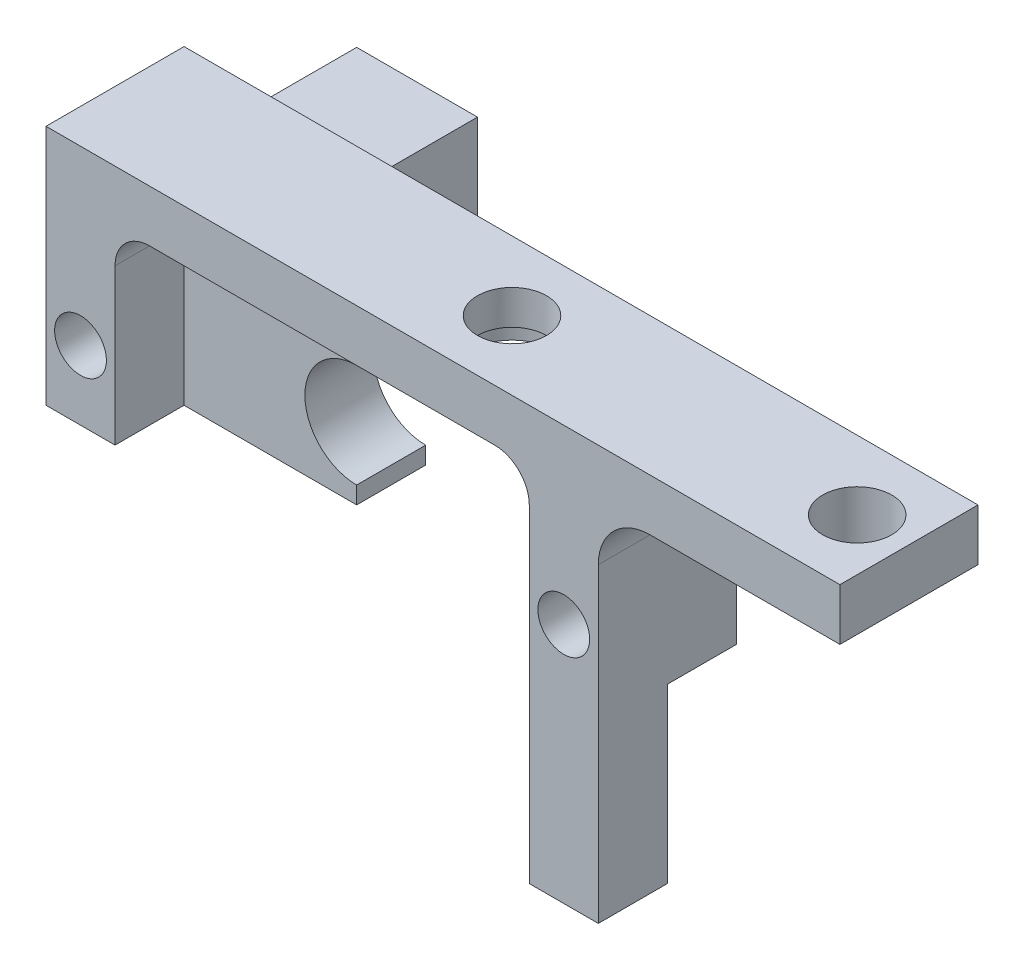
from build123d import *

# Parameters (mm, degrees)
SKETCH_1_R          = 1.5
EXTRUDE_1_DEPTH     = 8
EXTRUDE_2_DEPTH     = 4
SKETCH_4_W          = 7
SKETCH_4_H          = 14
EXTRUDE_3_DEPTH     = 10
CUT_EXTRUDE_START   = -3
CUT_EXTRUDE_1_DEPTH = 7
SKETCH_6_W          = 7
SKETCH_6_H          = 5.039650546
CUT_EXTRUDE_3_DEPTH = 10
CUT_EXTRUDE_START_2 = -10
SKETCH_7_R          = 1.5
CUT_EXTRUDE_4_DEPTH = 10
SKETCH_9_W          = 8
SKETCH_9_H          = 3
EXTRUDE_4_DEPTH     = 7
FILLET_3_R          = 3
FILLET_4_R          = 2
SKETCH_10_W         = 4
SKETCH_10_H         = 4
EXTRUDE_5_DEPTH     = 10
SKETCH_8_R          = 2
CUT_EXTRUDE_6_DEPTH = 10
SKETCH_13_R         = 2.5
CUT_EXTRUDE_7_DEPTH = 1
SKETCH_14_W         = 8
SKETCH_14_H         = 3
EXTRUDE_6_DEPTH     = 7
FILLET_5_R          = 2
SKETCH_15_R         = 2
CUT_EXTRUDE_8_DEPTH = 7


with BuildPart() as part:
    # 草图1 → 凸台-拉伸1 (new body)
    with BuildSketch(Plane.XY):
        Polygon((16, 7), (-16, 7), (-16, -7), (-12, -7), (-12, 4), (12, 4), (12, -7), (16, -7), align=None)
        with Locations((-14, -3)):
            Circle(SKETCH_1_R, mode=Mode.SUBTRACT)
        with Locations((14, -3)):
            Circle(SKETCH_1_R, mode=Mode.SUBTRACT)
    extrude(amount=EXTRUDE_1_DEPTH)

    # 草图3 → 凸台-拉伸2 (add)
    with BuildSketch(Plane(origin=(0, 0, 0), x_dir=(-1, 0, 0), z_dir=(0, 0, -1))):
        with BuildLine():
            Line((2, -7), (12, -7))
            Line((12, -7), (12, 1.960349454))
            Line((12, 1.960349454), (2, 1.960349454))
            Line((2, 1.960349454), (2, 0))
            ThreePointArc((2, 0), (4.121320344, -0.878679656), (5, -3))
            ThreePointArc((5, -3), (4.121320344, -5.121320344), (2, -6))
            Line((2, -6), (2, -7))
        make_face()
    extrude(amount=-EXTRUDE_2_DEPTH)

    # 草图4 → 凸台-拉伸3 (add)
    with BuildSketch(Plane(origin=(0, 0, 0), x_dir=(-1, 0, 0), z_dir=(0, 0, -1))):
        with Locations((12.5, 0)):
            Rectangle(SKETCH_4_W, SKETCH_4_H)
    extrude(amount=EXTRUDE_3_DEPTH)

    # 草图5 → 切除-拉伸1 (cut)
    with BuildSketch(Plane(origin=(0, 0, -10), x_dir=(-1, 0, 0), z_dir=(0, 0, -1)).offset(CUT_EXTRUDE_START)):
        with BuildLine():
            ThreePointArc((12.209881979, -3), (11.697318846, -1.762563133), (10.459881979, -1.25))
            ThreePointArc((10.459881979, -1.25), (9.631108119, -1.458690852), (9, -2.034989841))
            Line((9, -2.034989841), (9, -3.965010159))
            ThreePointArc((9, -3.965010159), (10.963720513, -4.675901767), (12.209881979, -3))
        make_face()
        with BuildLine():
            Line((9, -3.965010159), (9, -2.034989841))
            ThreePointArc((9, -2.034989841), (8.709881979, -3), (9, -3.965010159))
        make_face()
        with BuildLine():
            ThreePointArc((11.753305584, -7), (12.095368491, -5.012986712), (12.209881979, -3))
            ThreePointArc((12.209881979, -3), (10.963720513, -4.675901767), (9, -3.965010159))
            Line((9, -3.965010159), (9, -7))
            Line((9, -7), (11.753305584, -7))
        make_face()
        with BuildLine():
            Line((10.459881979, -1.25), (9, -1.204378688))
            Line((9, -1.204378688), (9, -2.034989841))
            ThreePointArc((9, -2.034989841), (9.631108119, -1.458690852), (10.459881979, -1.25))
        make_face()
    extrude(amount=-CUT_EXTRUDE_1_DEPTH, mode=Mode.SUBTRACT)

    # 草图6 → 切除-拉伸3 (cut)
    with BuildSketch(Plane(origin=(0, 0, -10), x_dir=(-1, 0, 0), z_dir=(0, 0, -1))):
        with Locations((12.5, 4.480174727)):
            Rectangle(SKETCH_6_W, SKETCH_6_H)
    extrude(amount=-CUT_EXTRUDE_3_DEPTH, mode=Mode.SUBTRACT)

    # 草图7 → 切除-拉伸4 (cut)
    with BuildSketch(Plane.XY.offset(CUT_EXTRUDE_START_2)):
        with Locations((-14, -3)):
            Circle(SKETCH_7_R)
    extrude(amount=CUT_EXTRUDE_4_DEPTH, mode=Mode.SUBTRACT)

    # 草图9 → 凸台-拉伸4 (add)
    with BuildSketch(Plane(origin=(16, 0, 0), x_dir=(0, 0, -1), z_dir=(1, 0, 0))):
        with Locations((-4, 5.5)):
            Rectangle(SKETCH_9_W, SKETCH_9_H)
    extrude(amount=EXTRUDE_4_DEPTH)

    # 圆角3
    # the kernel refuses this fillet: 3 mm, written as the material it adds along each edge
    with BuildSketch(Plane(origin=(-16, 1.960349454, 0), x_dir=(0, 0, -1), z_dir=(1, 0, 0))) as fillet_3_piece_1:
        with BuildLine():
            CenterArc((FILLET_3_R, FILLET_3_R), FILLET_3_R, 180, 90)
            Line((0, FILLET_3_R), (0, 0))
            Line((0, 0), (FILLET_3_R, 0))
        make_face()
    extrude(amount=4)
    with BuildSketch(Plane(origin=(16, 4, 0), x_dir=(1, 0, 0), z_dir=(0, 0, 1))) as fillet_3_piece_2:
        with BuildLine():
            CenterArc((FILLET_3_R, -FILLET_3_R), FILLET_3_R, 90, 90)
            Line((0, -FILLET_3_R), (0, 0))
            Line((0, 0), (FILLET_3_R, 0))
        make_face()
    extrude(amount=8)

    # 圆角4
    fillet_4_edges = [part.edges().sort_by_distance(p)[0] for p in [
        (-12, 4, 4),
    ]]
    fillet(fillet_4_edges, radius=FILLET_4_R)

    # 草图10 → 凸台-拉伸5 (add)
    with BuildSketch(Plane.XZ.offset(7)):
        with Locations((14, 6)):
            Rectangle(SKETCH_10_W, SKETCH_10_H)
    extrude(amount=EXTRUDE_5_DEPTH)

    # 草图8 → 切除-拉伸6 (cut)
    with BuildSketch(Plane(origin=(0, 7, 0), x_dir=(1, 0, 0), z_dir=(0, 1, 0))):
        with Locations(Location((7, -4, 0), (0, 0, 270))):
            Circle(SKETCH_8_R)
        with Locations((27, -4)):
            Circle(SKETCH_8_R)
    extrude(amount=-CUT_EXTRUDE_6_DEPTH, mode=Mode.SUBTRACT)

    # 草图13 → 切除-拉伸7 (cut)
    with BuildSketch(Plane.XZ.offset(-4)):
        with Locations(Location((7, 4, 0), (0, 0, 270))):
            Circle(SKETCH_13_R)
    extrude(amount=-CUT_EXTRUDE_7_DEPTH, mode=Mode.SUBTRACT)

    # 草图14 → 凸台-拉伸6 (add)
    with BuildSketch(Plane(origin=(23, 0, 0), x_dir=(0, 0, -1), z_dir=(1, 0, 0))):
        with Locations((-4, 5.5)):
            Rectangle(SKETCH_14_W, SKETCH_14_H)
    extrude(amount=EXTRUDE_6_DEPTH)

    # 圆角5
    fillet_5_edges = [part.edges().sort_by_distance(p)[0] for p in [
        (12, 4, 4),
    ]]
    fillet(fillet_5_edges, radius=FILLET_5_R)

    # 草图15 → 切除-拉伸8 (cut)
    with BuildSketch(Plane(origin=(0, 7, 0), x_dir=(1, 0, 0), z_dir=(0, 1, 0))):
        with Locations(Location((27, -4, 0), (0, 0, 270))):
            Circle(SKETCH_15_R)
        with Locations(Location((7, -4, 0), (0, 0, 270))):
            Circle(SKETCH_15_R)
    extrude(amount=-CUT_EXTRUDE_8_DEPTH, mode=Mode.SUBTRACT)


solid = part.part
